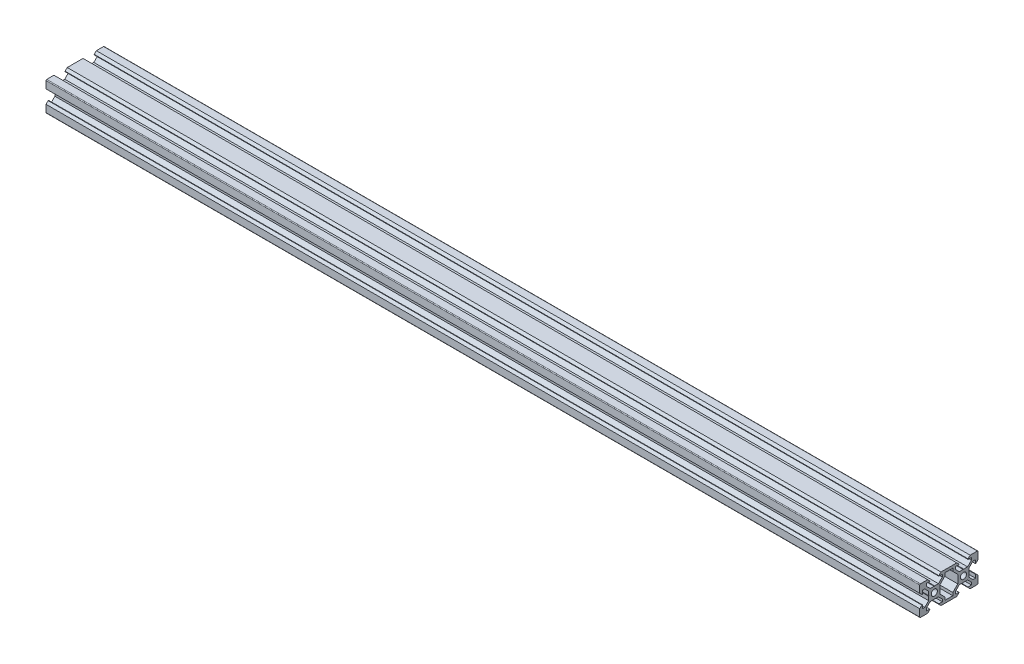
from build123d import *

# Parameters (mm, degrees)
PROFILE_SKETCH_R      = 2.1
PROFILE_EXTRUDE_DEPTH = 600


with BuildPart() as part:
    # Profile Sketch → Profile Extrude (new body)
    with BuildSketch(Plane(origin=(0, 0, 0), x_dir=(0, 0, -1), z_dir=(1, 0, 0))):
        with BuildLine():
            Line((6.875, 8.545), (5.42, 10))
            Line((5.42, 10), (-5.42, 10))
            Line((-5.42, 10), (-6.875, 8.545))
            Line((-6.875, 8.545), (-6.875, 8.2))
            Line((-6.875, 8.2), (-4.5, 8.2))
            Line((-4.5, 8.2), (-4.5, 6.56))
            Line((-4.5, 6.56), (-7.16, 3.9))
            Line((-7.16, 3.9), (-9.79, 3.9))
            Line((-9.79, 3.9), (-10, 3.69))
            Line((-10, 3.69), (-10.21, 3.9))
            Line((-10.21, 3.9), (-12.84, 3.9))
            Line((-12.84, 3.9), (-15.5, 6.56))
            Line((-15.5, 6.56), (-15.5, 8.2))
            Line((-15.5, 8.2), (-13.125, 8.2))
            Line((-13.125, 8.2), (-13.125, 8.545))
            Line((-13.125, 8.545), (-14.58, 10))
            Line((-14.58, 10), (-19.5, 10))
            ThreePointArc((-19.5, 10), (-19.853553391, 9.853553391), (-20, 9.5))
            Line((-20, 9.5), (-20, 4.58))
            Line((-20, 4.58), (-18.545, 3.125))
            Line((-18.545, 3.125), (-18.2, 3.125))
            Line((-18.2, 3.125), (-18.2, 5.5))
            Line((-18.2, 5.5), (-16.56, 5.5))
            Line((-16.56, 5.5), (-13.9, 2.838679656))
            Line((-13.9, 2.838679656), (-13.9, 0.21))
            Line((-13.9, 0.21), (-13.69, 0))
            Line((-13.69, 0), (-13.9, -0.21))
            Line((-13.9, -0.21), (-13.9, -2.838679656))
            Line((-13.9, -2.838679656), (-16.56, -5.5))
            Line((-16.56, -5.5), (-18.2, -5.5))
            Line((-18.2, -5.5), (-18.2, -3.125))
            Line((-18.2, -3.125), (-18.545, -3.125))
            Line((-18.545, -3.125), (-20, -4.58))
            Line((-20, -4.58), (-20, -9.5))
            ThreePointArc((-20, -9.5), (-19.853553391, -9.853553391), (-19.5, -10))
            Line((-19.5, -10), (-14.58, -10))
            Line((-14.58, -10), (-13.125, -8.545))
            Line((-13.125, -8.545), (-13.125, -8.2))
            Line((-13.125, -8.2), (-15.5, -8.2))
            Line((-15.5, -8.2), (-15.5, -6.56))
            Line((-15.5, -6.56), (-12.84, -3.9))
            Line((-12.84, -3.9), (-10.21, -3.9))
            Line((-10.21, -3.9), (-10, -3.69))
            Line((-10, -3.69), (-9.79, -3.9))
            Line((-9.79, -3.9), (-7.16, -3.9))
            Line((-7.16, -3.9), (-4.5, -6.56))
            Line((-4.5, -6.56), (-4.5, -8.2))
            Line((-4.5, -8.2), (-6.875, -8.2))
            Line((-6.875, -8.2), (-6.875, -8.545))
            Line((-6.875, -8.545), (-5.42, -10))
            Line((-5.42, -10), (5.42, -10))
            Line((5.42, -10), (6.875, -8.545))
            Line((6.875, -8.545), (6.875, -8.2))
            Line((6.875, -8.2), (4.5, -8.2))
            Line((4.5, -8.2), (4.5, -6.56))
            Line((4.5, -6.56), (7.16, -3.9))
            Line((7.16, -3.9), (9.79, -3.9))
            Line((9.79, -3.9), (10, -3.69))
            Line((10, -3.69), (10.21, -3.9))
            Line((10.21, -3.9), (12.84, -3.9))
            Line((12.84, -3.9), (15.5, -6.56))
            Line((15.5, -6.56), (15.5, -8.2))
            Line((15.5, -8.2), (13.125, -8.2))
            Line((13.125, -8.2), (13.125, -8.545))
            Line((13.125, -8.545), (14.58, -10))
            Line((14.58, -10), (19.5, -10))
            ThreePointArc((19.5, -10), (19.853553391, -9.853553391), (20, -9.5))
            Line((20, -9.5), (20, -4.58))
            Line((20, -4.58), (18.545, -3.125))
            Line((18.545, -3.125), (18.2, -3.125))
            Line((18.2, -3.125), (18.2, -5.5))
            Line((18.2, -5.5), (16.56, -5.5))
            Line((16.56, -5.5), (13.9, -2.838679656))
            Line((13.9, -2.838679656), (13.9, -0.21))
            Line((13.9, -0.21), (13.69, 0))
            Line((13.69, 0), (13.9, 0.21))
            Line((13.9, 0.21), (13.9, 2.838679656))
            Line((13.9, 2.838679656), (16.56, 5.5))
            Line((16.56, 5.5), (18.2, 5.5))
            Line((18.2, 5.5), (18.2, 3.125))
            Line((18.2, 3.125), (18.545, 3.125))
            Line((18.545, 3.125), (20, 4.58))
            Line((20, 4.58), (20, 9.5))
            ThreePointArc((20, 9.5), (19.853553391, 9.853553391), (19.5, 10))
            Line((19.5, 10), (14.58, 10))
            Line((14.58, 10), (13.125, 8.545))
            Line((13.125, 8.545), (13.125, 8.2))
            Line((13.125, 8.2), (15.5, 8.2))
            Line((15.5, 8.2), (15.5, 6.56))
            Line((15.5, 6.56), (12.84, 3.9))
            Line((12.84, 3.9), (10.21, 3.9))
            Line((10.21, 3.9), (10, 3.69))
            Line((10, 3.69), (9.79, 3.9))
            Line((9.79, 3.9), (7.16, 3.9))
            Line((7.16, 3.9), (4.5, 6.56))
            Line((4.5, 6.56), (4.5, 8.2))
            Line((4.5, 8.2), (6.875, 8.2))
            Line((6.875, 8.2), (6.875, 8.545))
        make_face()
        with Locations((-10, 0)):
            Circle(PROFILE_SKETCH_R, mode=Mode.SUBTRACT)
        with Locations((10, 0)):
            Circle(PROFILE_SKETCH_R, mode=Mode.SUBTRACT)
        Polygon((-2.7, 8.2), (2.7, 8.2), (2.7, 6.238679656), (6.1, 2.838679656), (6.1, -0.21), (6.1, -2.838679656), (2.7, -6.238679656), (2.7, -8.2), (-2.7, -8.2), (-2.7, -6.238679656), (-6.1, -2.838679656), (-6.1, -0.21), (-6.1, 2.838679656), (-2.7, 6.238679656), align=None, mode=Mode.SUBTRACT)
    extrude(amount=PROFILE_EXTRUDE_DEPTH)


solid = part.part
